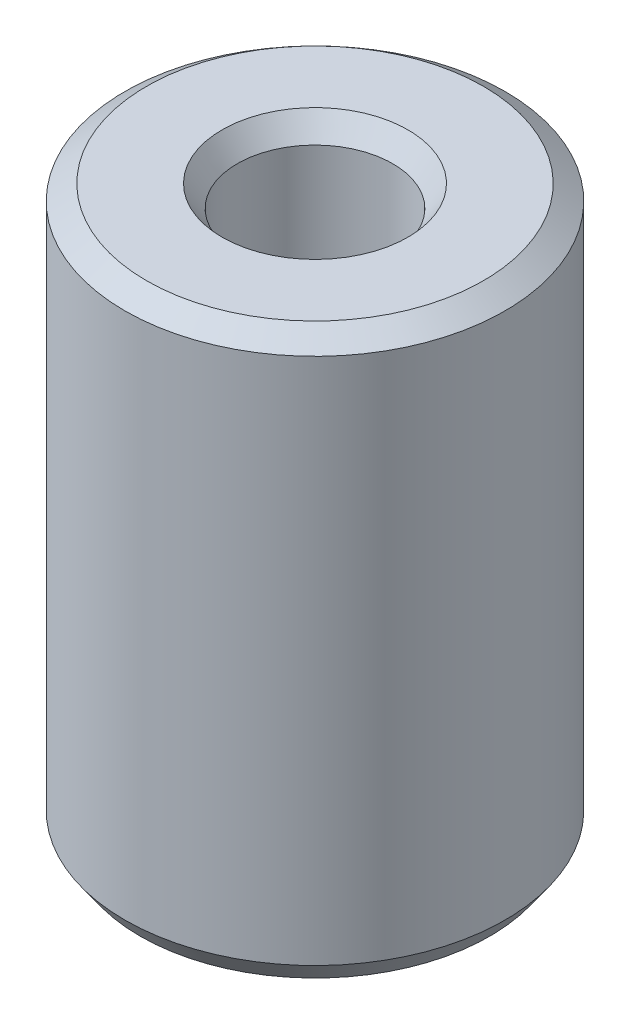
from build123d import *
from OCP.BRepFilletAPI import BRepFilletAPI_MakeChamfer

# Parameters (mm, degrees)
SKETCH1_R           = 15
BOSS_EXTRUDE1_DEPTH = 44.551441747
SKETCH2_R           = 6.133679218
CUT_EXTRUDE1_DEPTH  = 50.34400634
CHAMFER1_SIZE       = 1.205690718
CHAMFER1_SIZE2      = 1.707443348


with BuildPart() as part:
    # Sketch1 → Boss-Extrude1 (new body)
    with BuildSketch(Plane(origin=(0, 0, 0), x_dir=(1, 0, 0), z_dir=(0, 1, 0))):
        Circle(SKETCH1_R)
    extrude(amount=BOSS_EXTRUDE1_DEPTH)

    # Sketch2 → Cut-Extrude1 (cut, through all)
    with BuildSketch(Plane(origin=(0, 0, 0), x_dir=(1, 0, 0), z_dir=(0, 1, 0))):
        Circle(SKETCH2_R)
    extrude(amount=CUT_EXTRUDE1_DEPTH, mode=Mode.SUBTRACT)

    # Chamfer1: one chamfer whose edges measure the first distance from different faces: ONE call of the kernel's chamfer builder (chamfer() names one face for all edges)
    chamfer1_edges_1 = [part.edges().sort_by_distance(p)[0] for p in [
        (-6.133679218, 44.551441747, 0),
    ]]
    chamfer1_side_1 = [part.faces().sort_by_distance(p)[0] for p in [
        (-14.575735931, 44.551441747, 0),
    ]]
    chamfer1_edges_2 = [part.edges().sort_by_distance(p)[0] for p in [
        (-6.133679218, 0, 0),
    ]]
    chamfer1_side_2 = [part.faces().sort_by_distance(p)[0] for p in [
        (-6.133679218, 22.275720873, 0),
    ]]
    chamfer1_edges_3 = [part.edges().sort_by_distance(p)[0] for p in [
        (-15, 0, 0),
    ]]
    chamfer1_side_3 = [part.faces().sort_by_distance(p)[0] for p in [
        (-14.575735931, 0, 0),
    ]]
    chamfer1_edges_4 = [part.edges().sort_by_distance(p)[0] for p in [
        (-15, 44.551441747, 0),
    ]]
    chamfer1_side_4 = [part.faces().sort_by_distance(p)[0] for p in [
        (-15, 22.275720873, 0),
    ]]
    chamfer1 = BRepFilletAPI_MakeChamfer(part.part.solid().wrapped)
    for e in chamfer1_edges_1:
        chamfer1.Add(CHAMFER1_SIZE, CHAMFER1_SIZE2, e.wrapped, chamfer1_side_1[0].wrapped)  # the first distance lies on this face
    for e in chamfer1_edges_2:
        chamfer1.Add(CHAMFER1_SIZE, CHAMFER1_SIZE2, e.wrapped, chamfer1_side_2[0].wrapped)  # the first distance lies on this face
    for e in chamfer1_edges_3:
        chamfer1.Add(CHAMFER1_SIZE, CHAMFER1_SIZE2, e.wrapped, chamfer1_side_3[0].wrapped)  # the first distance lies on this face
    for e in chamfer1_edges_4:
        chamfer1.Add(CHAMFER1_SIZE, CHAMFER1_SIZE2, e.wrapped, chamfer1_side_4[0].wrapped)  # the first distance lies on this face
    add(Compound.cast(chamfer1.Shape()), mode=Mode.REPLACE)


solid = part.part
